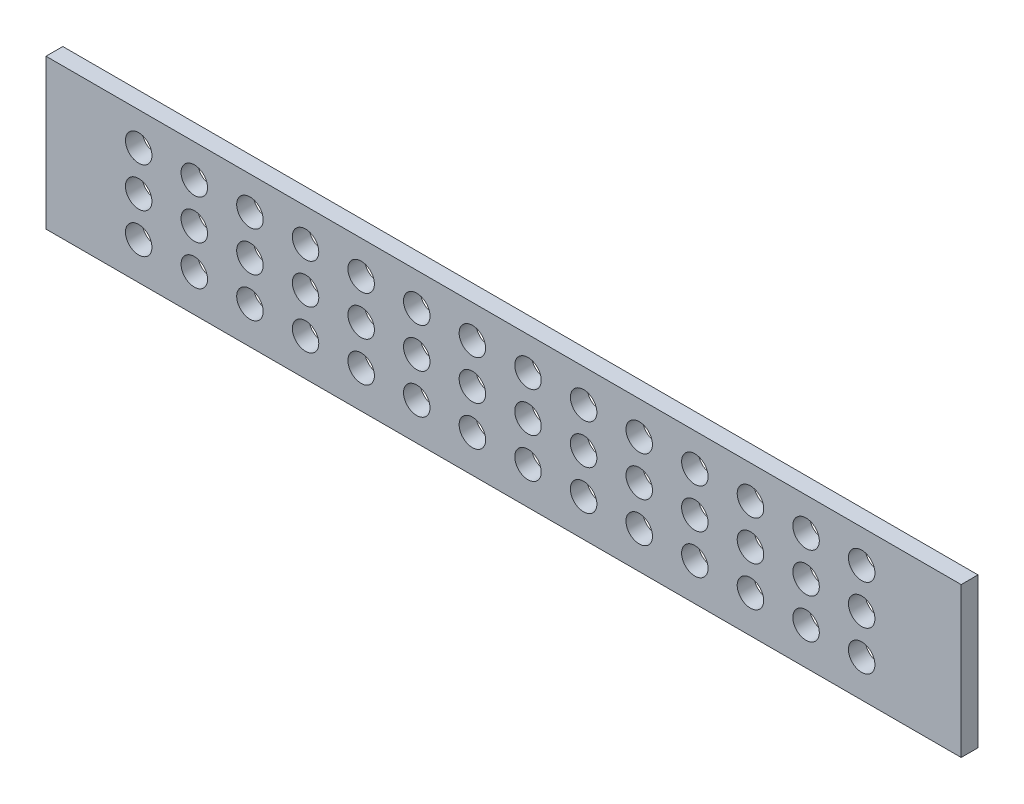
from build123d import *

# Parameters (mm, degrees)
SKETCH1_W            = 345.57
SKETCH1_H            = 56.55
BOSS_EXTRUDE1_DEPTH  = 6.35
CUT_EXTRUDE1_DEPTH   = 10
LPATTERN1_COUNT      = 14
LPATTERN1_PITCH      = 21
LPATTERN1_COUNT_DIR2 = 3
LPATTERN1_PITCH_DIR2 = 15


with BuildPart() as part:
    # Sketch1 → Boss-Extrude1 (new body)
    with BuildSketch(Plane.XY):
        Rectangle(SKETCH1_W, SKETCH1_H)
    extrude(amount=BOSS_EXTRUDE1_DEPTH)

    # Sketch2 → Cut-Extrude1 (cut)
    with BuildSketch(Plane.XY.offset(6.35)):
        with BuildLine():
            ThreePointArc((-132.785, 15.775), (-134.249466094, 19.310533906), (-137.785, 20.775))
            ThreePointArc((-137.785, 20.775), (-141.320533906, 19.310533906), (-142.785, 15.775))
            ThreePointArc((-142.785, 15.775), (-137.785, 10.775), (-132.785, 15.775))
        make_face()
    cut_extrude1 = extrude(amount=-CUT_EXTRUDE1_DEPTH, mode=Mode.SUBTRACT)

    # LPattern1: Cut-Extrude1 14 × 3
    with Locations(*[(i * LPATTERN1_PITCH, -j * LPATTERN1_PITCH_DIR2, 0) for i in range(LPATTERN1_COUNT) for j in range(LPATTERN1_COUNT_DIR2) if (i, j) != (0, 0)]):
        add(cut_extrude1, mode=Mode.SUBTRACT)


solid = part.part
